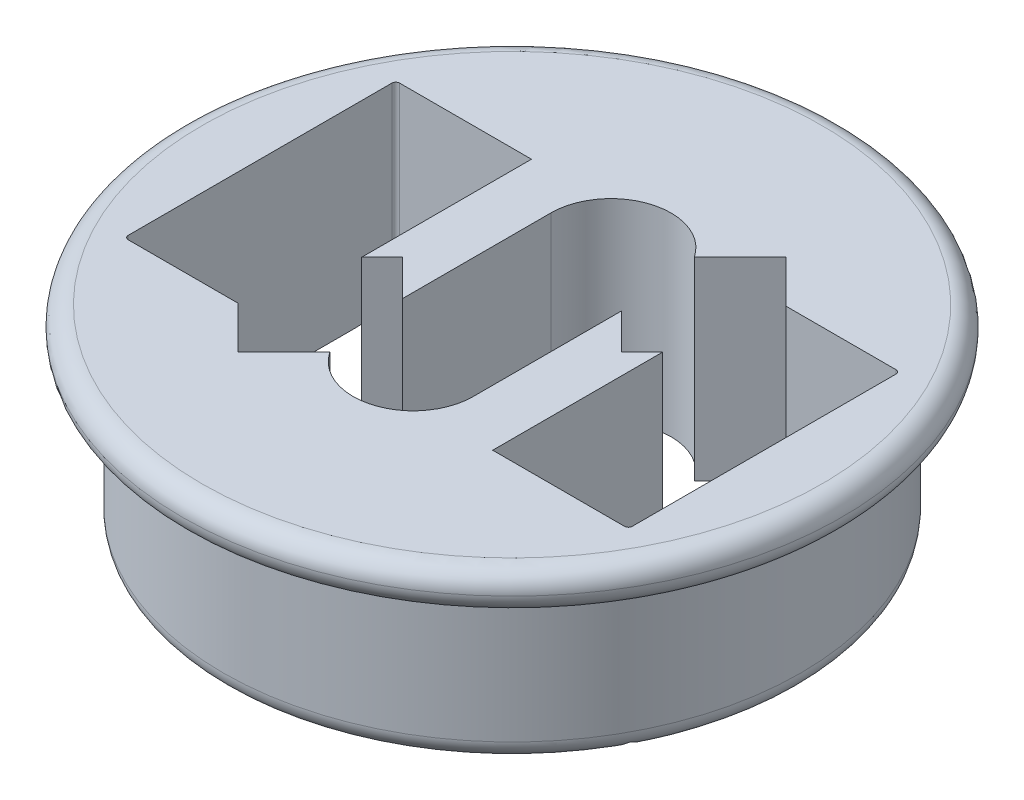
from build123d import *

# Parameters (mm, degrees)
SKETCH1_R           = 7.45
BOSS_EXTRUDE1_DEPTH = 4
SKETCH2_R           = 8.5
BOSS_EXTRUDE2_DEPTH = 1
SKETCH3_W           = 3.5
SKETCH3_H           = 3.5
CUT_EXTRUDE1_DEPTH  = 14.019216566
CUT_EXTRUDE2_DEPTH  = 14.019216566
CUT_EXTRUDE3_DEPTH  = 14.019216566
FILLET3_R           = 0.5
FILLET5_R           = 0.1


with BuildPart() as part:
    # Sketch1 → Boss-Extrude1 (new body)
    with BuildSketch(Plane(origin=(0, 0, 0), x_dir=(1, 0, 0), z_dir=(0, 1, 0))):
        with Locations(Location((0, 0, 0), (0, 0, 270))):
            Circle(SKETCH1_R)
    extrude(amount=BOSS_EXTRUDE1_DEPTH)

    # Sketch2 → Boss-Extrude2 (add)
    with BuildSketch(Plane(origin=(0, 4, 0), x_dir=(1, 0, 0), z_dir=(0, 1, 0))):
        with Locations(Location((0, 0, 0), (0, 0, 270))):
            Circle(SKETCH2_R)
    extrude(amount=BOSS_EXTRUDE2_DEPTH)

    # Sketch3 → Cut-Extrude1 (cut, through all)
    with BuildSketch(Plane(origin=(0, 5, 0), x_dir=(1, 0, 0), z_dir=(0, 1, 0))):
        with Locations((-4.75, 1.75)):
            Rectangle(SKETCH3_W, SKETCH3_H)
        with Locations((-4.75, -1.75)):
            Rectangle(SKETCH3_W, SKETCH3_H)
        with Locations((4.75, -1.75)):
            Rectangle(SKETCH3_W, SKETCH3_H)
        with Locations((4.75, 1.75)):
            Rectangle(SKETCH3_W, SKETCH3_H)
    extrude(amount=-CUT_EXTRUDE1_DEPTH, mode=Mode.SUBTRACT)

    # Sketch3<4> → Cut-Extrude2 (cut, through all)
    with BuildSketch(Plane(origin=(0, 5, 0), x_dir=(1, 0, 0), z_dir=(0, 1, 0))):
        with BuildLine():
            Line((-1.55, -2.55), (-1.55, 2.55))
            ThreePointArc((-1.55, 2.55), (0, 4.1), (1.55, 2.55))
            Line((1.55, 2.55), (1.55, -2.55))
            ThreePointArc((1.55, -2.55), (0, -4.1), (-1.55, -2.55))
        make_face()
    extrude(amount=-CUT_EXTRUDE2_DEPTH, mode=Mode.SUBTRACT)

    # Sketch3<5> → Cut-Extrude3 (cut, through all)
    with BuildSketch(Plane(origin=(0, 5, 0), x_dir=(1, 0, 0), z_dir=(0, 1, 0))):
        Polygon((0.353553391, 2.474873734), (2.474873734, 4.596194078), (4.596194078, 2.474873734), (2.474873734, 0.353553391), align=None)
        Polygon((-4.596194078, -2.474873734), (-2.474873734, -4.596194078), (-0.353553391, -2.474873734), (-2.474873734, -0.353553391), align=None)
    extrude(amount=-CUT_EXTRUDE3_DEPTH, mode=Mode.SUBTRACT)

    # Fillet3
    # the kernel refuses this fillet: 0.5 mm, written as the material it takes off along each edge
    with BuildSketch(Plane(origin=(0, 0, 0), x_dir=(0, 0, 1), z_dir=(-1, 0, 0))) as fillet3_piece_1:
        with BuildLine():
            CenterArc((7.45 - FILLET3_R, FILLET3_R), FILLET3_R, 270, 90)
            Line((7.45 - FILLET3_R, 0), (7.45, 0))
            Line((7.45, 0), (7.45, FILLET3_R))
        make_face()
    revolve(axis=Axis((0, 0, 0), (0, 1, 0)), mode=Mode.SUBTRACT)
    with BuildSketch(Plane(origin=(0, 4, 0), x_dir=(0, 0, 1), z_dir=(-1, 0, 0))) as fillet3_piece_2:
        with BuildLine():
            CenterArc((8.5 - FILLET3_R, FILLET3_R), FILLET3_R, 270, 90)
            Line((8.5 - FILLET3_R, 0), (8.5, 0))
            Line((8.5, 0), (8.5, FILLET3_R))
        make_face()
    revolve(axis=Axis((0, 4, 0), (0, 1, 0)), mode=Mode.SUBTRACT)
    with BuildSketch(Plane(origin=(0, 5, 0), x_dir=(0, 0, 1), z_dir=(-1, 0, 0))) as fillet3_piece_3:
        with BuildLine():
            CenterArc((8.5 - FILLET3_R, -FILLET3_R), FILLET3_R, 0, 90)
            Line((8.5 - FILLET3_R, 0), (8.5, 0))
            Line((8.5, 0), (8.5, -FILLET3_R))
        make_face()
    revolve(axis=Axis((0, 5, 0), (0, 1, 0)), mode=Mode.SUBTRACT)

    # Fillet5
    fillet5_edges = [part.edges().sort_by_distance(p)[0] for p in [
        (-6.5, 2.62448081, 3.5),
        (-6.5, 2.62448081, -3.5),
        (6.5, 2.62448081, 3.5),
        (6.5, 2.62448081, -3.5),
    ]]
    fillet(fillet5_edges, radius=FILLET5_R)


solid = part.part
